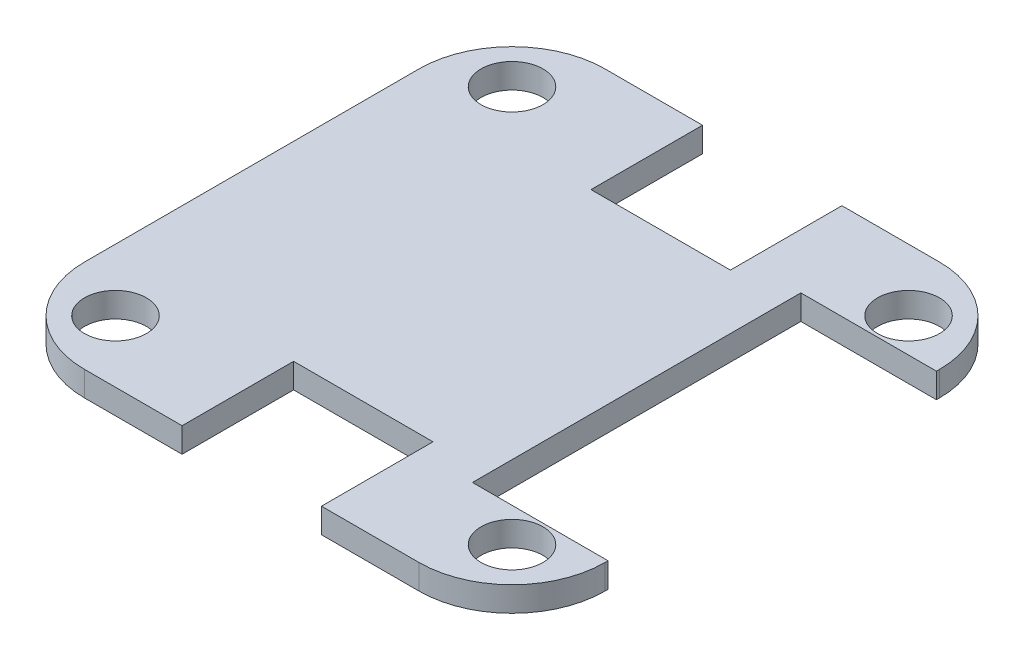
from build123d import *

# Parameters (mm, degrees)
BOSS_EXTRUDE1_DEPTH = 4
SKETCH4_W           = 21.88
SKETCH4_H           = 53
SKETCH4_R           = 5
CUT_EXTRUDE1_DEPTH  = 4


with BuildPart() as part:
    # Layer1 → Boss-Extrude1 (new body)
    with BuildSketch(Plane(origin=(0, 0, 0), x_dir=(1, 0, 0), z_dir=(0, 1, 0))):
        with BuildLine():
            Line((27, 42), (11.25, 42))
            Line((11.25, 42), (11.25, 24))
            Line((11.25, 24), (-11.25, 24))
            Line((-11.25, 24), (-11.25, 42))
            Line((-11.25, 42), (-27, 42))
            ThreePointArc((-27, 42), (-37.606601718, 37.606601718), (-42, 27))
            Line((-42, 27), (-42, 21.5))
            Line((-42, 21.5), (-42, -21.5))
            Line((-42, -21.5), (-42, -27))
            ThreePointArc((-42, -27), (-37.606601718, -37.606601718), (-27, -42))
            Line((-27, -42), (-11.25, -42))
            Line((-11.25, -42), (-11.25, -24))
            Line((-11.25, -24), (11.25, -24))
            Line((11.25, -24), (11.25, -42))
            Line((11.25, -42), (27, -42))
            ThreePointArc((27, -42), (37.606601718, -37.606601718), (42, -27))
            Line((42, -27), (42, 27))
            ThreePointArc((42, 27), (37.606601718, 37.606601718), (27, 42))
        make_face()
    extrude(amount=BOSS_EXTRUDE1_DEPTH)

    # Sketch4 → Cut-Extrude1 (cut)
    with BuildSketch(Plane(origin=(0, 4, 0), x_dir=(1, 0, 0), z_dir=(0, 1, 0))):
        with Locations((31.06, 0)):
            Rectangle(SKETCH4_W, SKETCH4_H)
        with Locations((-32, 32)):
            Circle(SKETCH4_R)
        with Locations((32, 32)):
            Circle(SKETCH4_R)
        with Locations((32, -32)):
            Circle(SKETCH4_R)
        with Locations((-32, -32)):
            Circle(SKETCH4_R)
    extrude(amount=-CUT_EXTRUDE1_DEPTH, mode=Mode.SUBTRACT)


solid = part.part
